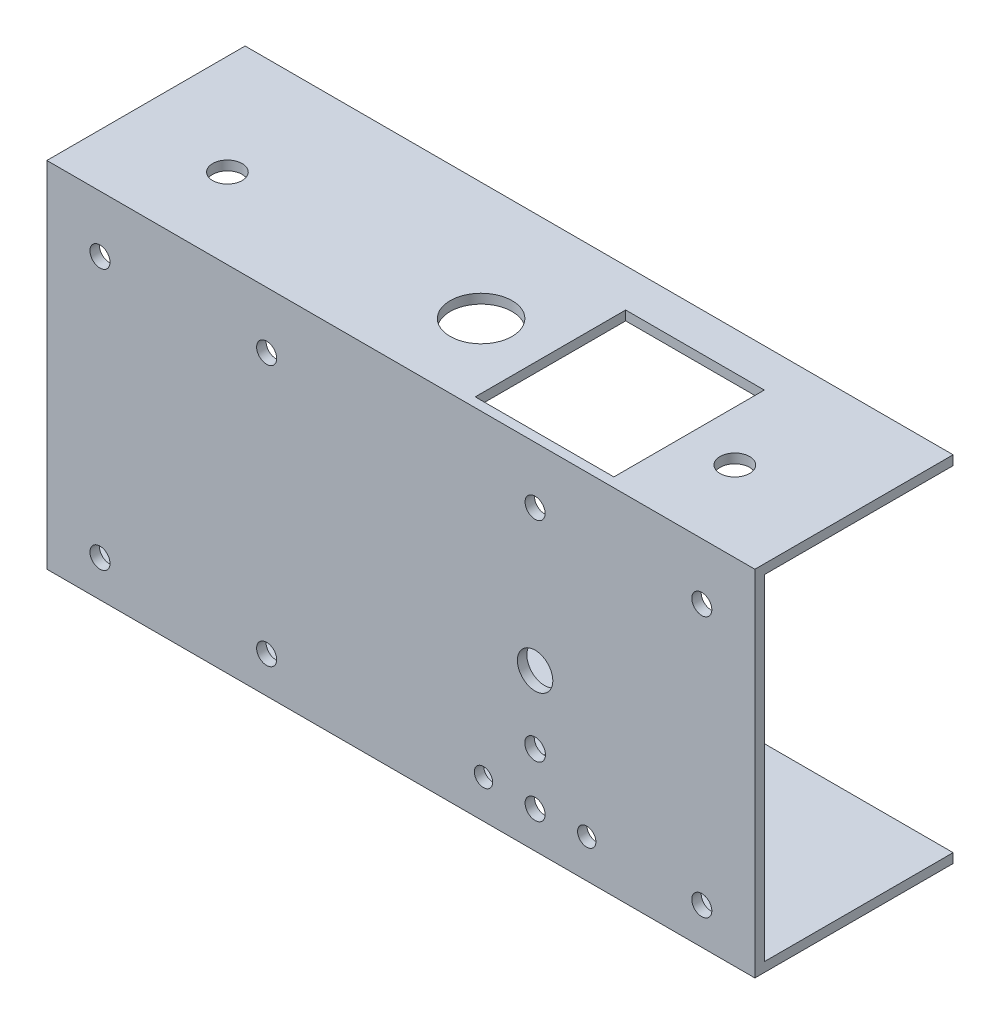
from build123d import *

# Parameters (mm, degrees)
SKETCH1_R           = 5.25
SKETCH1_R_2         = 2.5
BOSS_EXTRUDE1_DEPTH = 1.6
SKETCH3_W           = 120
SKETCH3_H           = 1.6
BOSS_EXTRUDE3_DEPTH = 60
SKETCH4_R           = 1.75
SKETCH4_R_2         = 3
SKETCH4_R_3         = 1.55
CUT_EXTRUDE1_DEPTH  = 10
SKETCH6_R           = 1.7
CUT_EXTRUDE2_DEPTH  = 25


with BuildPart() as part:
    # Sketch1 → Boss-Extrude1 (new body)
    with BuildSketch(Plane(origin=(0, 0, 0), x_dir=(1, 0, 0), z_dir=(0, 1, 0))):
        Polygon((34.5, -12), (34.5, 13.5), (11, 13.5), (11, -12), (-60, -12), (-60, 20), (60, 20), (60, -12), align=None)
        Circle(SKETCH1_R, mode=Mode.SUBTRACT)
        with Locations((-43, 0)):
            Circle(SKETCH1_R_2, mode=Mode.SUBTRACT)
        with Locations((43, 0)):
            Circle(SKETCH1_R_2, mode=Mode.SUBTRACT)
    boss_extrude1 = extrude(amount=BOSS_EXTRUDE1_DEPTH)

    # Sketch3 → Boss-Extrude3 (add)
    with BuildSketch(Plane.XZ):
        with Locations((0, 12.8)):
            Rectangle(SKETCH3_W, SKETCH3_H)
    extrude(amount=-BOSS_EXTRUDE3_DEPTH)

    # Mirror1: Boss-Extrude1 across plane
    add(boss_extrude1.mirror(Plane.ZX.offset(30)))

    # Sketch4 → Cut-Extrude1 (cut)
    with BuildSketch(Plane.XY.offset(12)):
        with Locations((22.75, 15)):
            Circle(SKETCH4_R)
        with Locations((22.75, 26.5)):
            Circle(SKETCH4_R_2)
        with Locations((31.5, 6.5)):
            Circle(SKETCH4_R_3)
        with Locations((14, 6.5)):
            Circle(SKETCH4_R_3)
    extrude(amount=CUT_EXTRUDE1_DEPTH, mode=Mode.SUBTRACT)

    # Sketch6 → Cut-Extrude2 (cut)
    with BuildSketch(Plane(origin=(124.244525073, 40.7, 12), x_dir=(1, 0, 0), z_dir=(0, 0, 1))):
        with Locations((-73.244525073, -34.5)):
            Circle(SKETCH6_R)
        with Locations((-101.494525073, -34.5)):
            Circle(SKETCH6_R)
        with Locations((-146.994525073, -34.5)):
            Circle(SKETCH6_R)
        with Locations((-175.244525073, -34.5)):
            Circle(SKETCH6_R)
        with Locations((-73.244525073, 9.7)):
            Circle(SKETCH6_R)
        with Locations((-101.494525073, 9.7)):
            Circle(SKETCH6_R)
        with Locations((-146.994525073, 9.7)):
            Circle(SKETCH6_R)
        with Locations((-175.244525073, 9.7)):
            Circle(SKETCH6_R)
    extrude(amount=CUT_EXTRUDE2_DEPTH, mode=Mode.SUBTRACT)


solid = part.part
